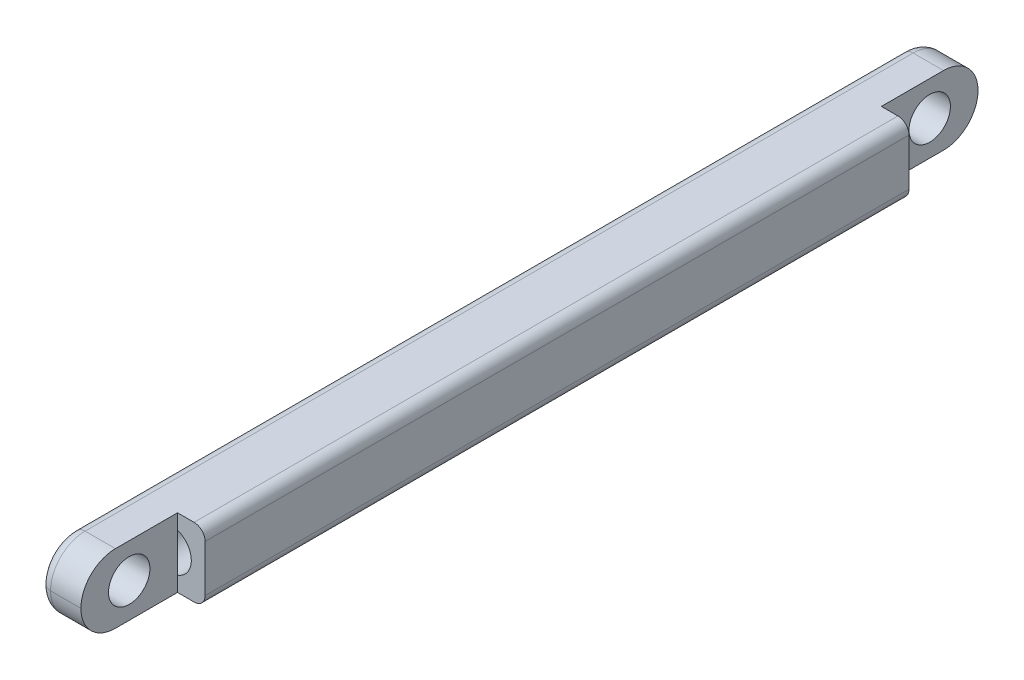
from build123d import *

# Parameters (mm, degrees)
SKETCH_1_W          = 5
SKETCH_1_H          = 5
EXTRUDE_1_DEPTH     = 51
SKETCH_2_R          = 1.5
CUT_EXTRUDE_1_DEPTH = 52.122402134
SKETCH_3_W          = 3
SKETCH_3_H          = 5
EXTRUDE_2_DEPTH     = 7
FILLET_1_R          = 2.5
SKETCH_4_R          = 1.5
CUT_EXTRUDE_2_DEPTH = 59.268773799
SKETCH_5_W          = 3
SKETCH_5_H          = 5
EXTRUDE_3_DEPTH     = 7
FILLET_2_R          = 2.5
SKETCH_6_R          = 1.5
CUT_EXTRUDE_3_DEPTH = 59.131316861
FILLET_3_R          = 0.8


with BuildPart() as part:
    # 草图1 → 凸台-拉伸1 (new body)
    with BuildSketch(Plane.XY):
        Rectangle(SKETCH_1_W, SKETCH_1_H)
    extrude(amount=EXTRUDE_1_DEPTH)

    # 草图2 → 切除-拉伸1 (cut, through all)
    with BuildSketch(Plane.XY.offset(51)):
        Circle(SKETCH_2_R)
    extrude(amount=-CUT_EXTRUDE_1_DEPTH, mode=Mode.SUBTRACT)

    # 草图3 → 凸台-拉伸2 (add)
    with BuildSketch(Plane.XY.offset(51)):
        with Locations((-1, 0)):
            Rectangle(SKETCH_3_W, SKETCH_3_H)
    extrude(amount=EXTRUDE_2_DEPTH)

    # 圆角1
    fillet_1_edges = [part.edges().sort_by_distance(p)[0] for p in [
        (-1, -2.5, 58),
        (-1, 2.5, 58),
    ]]
    fillet(fillet_1_edges, radius=FILLET_1_R - 0.0001)  # a hair under: the kernel refuses the full size

    # 草图4 → 切除-拉伸2 (cut, through all)
    with BuildSketch(Plane.ZY.offset(2.5)):
        with Locations(Location((54.5, 0, 0), (0, 0, 270))):
            Circle(SKETCH_4_R)
    extrude(amount=-CUT_EXTRUDE_2_DEPTH, mode=Mode.SUBTRACT)

    # 草图5 → 凸台-拉伸3 (add)
    with BuildSketch(Plane(origin=(0, 0, 0), x_dir=(-1, 0, 0), z_dir=(0, 0, -1))):
        with Locations((1, 0)):
            Rectangle(SKETCH_5_W, SKETCH_5_H)
    extrude(amount=EXTRUDE_3_DEPTH)

    # 圆角2
    fillet_2_edges = [part.edges().sort_by_distance(p)[0] for p in [
        (-1, -2.5, -7),
        (-1, 2.5, -7),
    ]]
    fillet(fillet_2_edges, radius=FILLET_2_R - 0.0001)  # a hair under: the kernel refuses the full size

    # 草图6 → 切除-拉伸3 (cut, through all)
    with BuildSketch(Plane(origin=(0.5, 0, 0), x_dir=(0, 0, -1), z_dir=(1, 0, 0))):
        with Locations((3.5, 0)):
            Circle(SKETCH_6_R)
    extrude(amount=-CUT_EXTRUDE_3_DEPTH, mode=Mode.SUBTRACT)

    # 圆角3
    fillet_3_edges = [part.edges().sort_by_distance(p)[0] for p in [
        (-2.5, 1.767796242, 57.267796242),
        (-2.5, -1.767796242, 57.267796242),
        (-2.5, -2.5, 25.5),
        (-2.5, -1.767796242, -6.267796242),
        (-2.5, 1.767796242, -6.267796242),
        (-2.5, 2.5, 25.5),
        (2.5, -2.5, 25.5),
        (2.5, 2.5, 25.5),
    ]]
    fillet(fillet_3_edges, radius=FILLET_3_R)


solid = part.part
